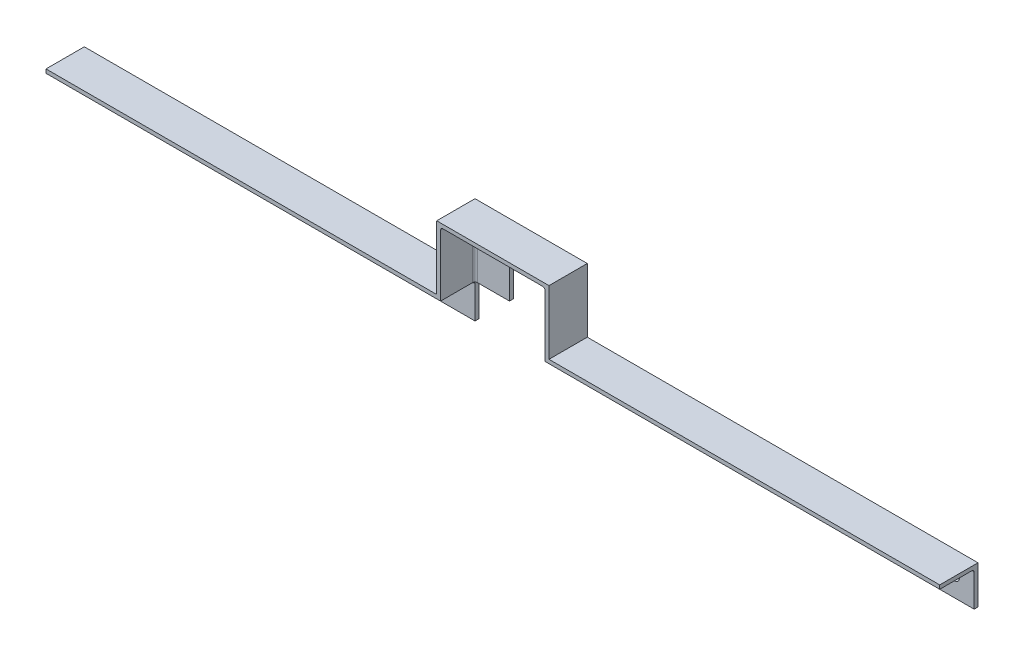
from build123d import *

# Parameters (mm, degrees)
BOSS_EXTRU_1_DEPTH      = 1.5
BOSS_EXTRU_2_DEPTH      = 13.5
D_GAGEMENT_M32_D        = 3.4
D_GAGEMENT_M32_DEPTH    = 10
D_GAGEMENT_M32_TIP      = 1.021463052
D_GAGEMENT_M31_D        = 3.4
D_GAGEMENT_M31_DEPTH    = 10
D_GAGEMENT_M31_TIP      = 1.021463052
ESQUISSE12_W            = 13.5
ESQUISSE12_H            = 13.5
ENL_V_MAT_EXTRU_1_DEPTH = 1.5
CONG_1_R                = 1
CONG_2_R                = 1


# Some blends are built 0.0001 mm under size
with BuildPart() as part:
    # Esquisse2 → Boss.-Extru.1 (new body)
    with BuildSketch(Plane.XY.offset(1.5)):
        Polygon((-25.392437762, 124.305889048), (-178.410591433, 124.305889048), (-178.410591433, 149.305889048), (-222.374284091, 149.305889048), (-222.374284091, 124.305889048), (-375.392437762, 124.305889048), (-375.392437762, 109.305889048), (-207.374284091, 109.305889048), (-207.374284091, 134.305889048), (-193.410591433, 134.305889048), (-193.410591433, 109.305889048), (-25.392437762, 109.305889048), align=None)
    extrude(amount=BOSS_EXTRU_1_DEPTH)

    # Esquisse3 → Boss.-Extru.2 (add)
    with BuildSketch(Plane.XY.offset(3)):
        Polygon((-375.392437762, 122.805889048), (-220.874284091, 122.805889048), (-220.874284091, 147.805889048), (-179.910591433, 147.805889048), (-179.910591433, 122.805889048), (-25.392437762, 122.805889048), (-25.392437762, 124.305889048), (-178.410591433, 124.305889048), (-178.410591433, 149.305889048), (-222.374284091, 149.305889048), (-222.374284091, 124.305889048), (-375.392437762, 124.305889048), align=None)
    extrude(amount=BOSS_EXTRU_2_DEPTH)

    # Dégagement M32
    with Locations(Plane(origin=(-229.874284091, 116.805889048, 3), x_dir=(1, 0, 0), z_dir=(0, 0, 1))):
        with Locations((0, 0), (-70.518153671, 0), (-138.018153671, 0), (58.963692658, 0), (129.481846329, 0), (196.981846329, 0)):
            Hole(D_GAGEMENT_M32_D / 2, depth=D_GAGEMENT_M32_DEPTH)
            with Locations((0, 0, -(D_GAGEMENT_M32_DEPTH + D_GAGEMENT_M32_TIP / 2))):  # 118° drill point
                Cone(0, D_GAGEMENT_M32_D / 2, D_GAGEMENT_M32_TIP, mode=Mode.SUBTRACT)

    # Dégagement M31
    with Locations(Plane(origin=(-214.874284091, 137.305889048, 3), x_dir=(1, 0, 0), z_dir=(0, 0, 1))):
        with Locations((0, 0), (28.963692658, 0)):
            Hole(D_GAGEMENT_M31_D / 2, depth=D_GAGEMENT_M31_DEPTH)
            with Locations((0, 0, -(D_GAGEMENT_M31_DEPTH + D_GAGEMENT_M31_TIP / 2))):  # 118° drill point
                Cone(0, D_GAGEMENT_M31_D / 2, D_GAGEMENT_M31_TIP, mode=Mode.SUBTRACT)

    # Esquisse12 → Enlèv. mat.-Extru.1 (cut)
    with BuildSketch(Plane.XY.offset(3)):
        with Locations((-214.124284091, 116.055889048)):
            Rectangle(ESQUISSE12_W, ESQUISSE12_H)
        with Locations((-186.660591433, 116.055889048)):
            Rectangle(ESQUISSE12_W, ESQUISSE12_H)
    extrude(amount=-ENL_V_MAT_EXTRU_1_DEPTH, mode=Mode.SUBTRACT)

    # Congé1
    # the kernel refuses this fillet: 1 mm, written as the material it adds along each edge
    with BuildSketch(Plane(origin=(-179.910591433, 122.805889048, 3), x_dir=(0, -1, 0), z_dir=(1, 0, 0))) as cong_1_piece_1:
        with BuildLine():
            CenterArc((CONG_1_R, -CONG_1_R), CONG_1_R, 90, 90)
            Line((0, -CONG_1_R), (0, 0))
            Line((0, 0), (CONG_1_R, 0))
        make_face()
    extrude(amount=154.518153671)
    with BuildSketch(Plane(origin=(-223.374284091, 147.805889048, 3), x_dir=(0, 0, 1), z_dir=(1, 0, 0))) as cong_1_piece_2_section:
        with BuildLine():
            CenterArc((CONG_1_R, CONG_1_R), CONG_1_R, 180, 90)
            Line((0, CONG_1_R), (0, 0))
            Line((0, 0), (CONG_1_R, 0))
        make_face()
    cong_1_piece_2 = extrude(amount=43.463692658, mode=Mode.PRIVATE)
    cong_1_piece_2 = split(cong_1_piece_2, bisect_by=Plane(origin=(-222.374284091, 147.582521109, 3.223367939), z_dir=(1, 0, 0)), keep=Keep.TOP, mode=Mode.PRIVATE)
    add(cong_1_piece_2)
    with BuildSketch(Plane(origin=(-375.392437762, 122.805889048, 3), x_dir=(0, 0, 1), z_dir=(1, 0, 0))) as cong_1_piece_3:
        with BuildLine():
            CenterArc((CONG_1_R, CONG_1_R), CONG_1_R, 180, 90)
            Line((0, CONG_1_R), (0, 0))
            Line((0, 0), (CONG_1_R, 0))
        make_face()
    extrude(amount=154.518153671)

    # Congé2
    cong_2_edges = [part.edges().sort_by_distance(p)[0] for p in [
        (-179.910591433, 134.805889048, 3),
        (-179.910591433, 147.512995829, 3.292893219),
        (-220.874284091, 147.512995829, 3.292893219),
        (-220.874284091, 134.805889048, 3),
        (-220.874284091, 147.805889048, 10.25),
        (-179.910591433, 147.805889048, 10.25),
    ]]
    fillet(cong_2_edges, radius=CONG_2_R - 0.0001)  # a hair under: the kernel refuses the full size


solid = part.part
